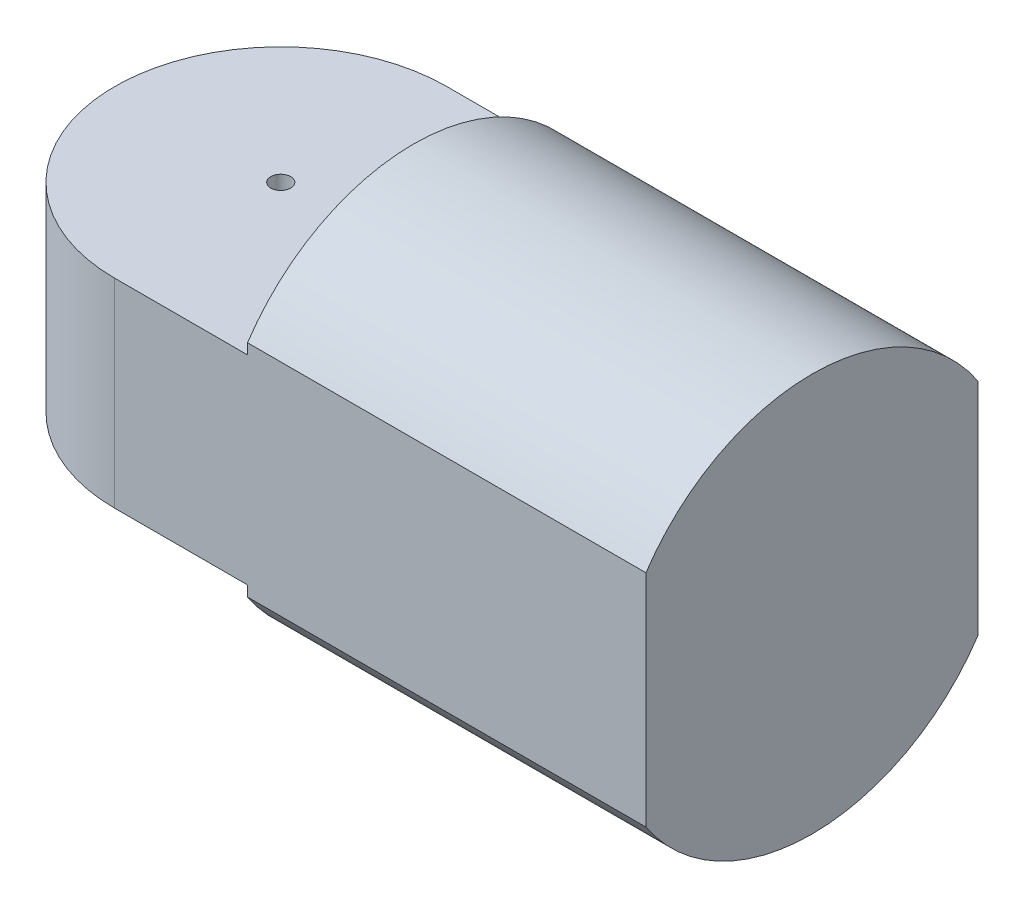
from build123d import *

# Parameters (mm, degrees)
BOSS_EXTRUDE1_DEPTH = 120
SKETCH2_W           = 100
SKETCH2_H           = 60
BOSS_EXTRUDE2_DEPTH = 90
CUT_EXTRUDE1_DEPTH  = 234.880311271
SKETCH4_R           = 3
CUT_EXTRUDE2_DEPTH  = 6


with BuildPart() as part:
    # Sketch1 → Boss-Extrude1 (new body)
    with BuildSketch(Plane(origin=(0, 0, 0), x_dir=(0, 0, -1), z_dir=(1, 0, 0))):
        with BuildLine():
            ThreePointArc((50, 33.166247904), (0, 60), (-50, 33.166247904))
            Line((-50, 33.166247904), (-50, -33.166247904))
            ThreePointArc((-50, -33.166247904), (0, -60), (50, -33.166247904))
            Line((50, -33.166247904), (50, 33.166247904))
        make_face()
    extrude(amount=-BOSS_EXTRUDE1_DEPTH)

    # Sketch2 → Boss-Extrude2 (add)
    with BuildSketch(Plane.ZY.offset(120)):
        Rectangle(SKETCH2_W, SKETCH2_H)
    extrude(amount=BOSS_EXTRUDE2_DEPTH)

    # Sketch3 → Cut-Extrude1 (cut, through all)
    with BuildSketch(Plane(origin=(0, 30, 0), x_dir=(1, 0, 0), z_dir=(0, 1, 0))):
        with BuildLine():
            ThreePointArc((-210, -4.09e-07), (-195.355339204, 35.355338915), (-160, 50))
            Line((-160, 50), (-210, 50))
            Line((-210, 50), (-210, -4.09e-07))
        make_face()
        with BuildLine():
            ThreePointArc((-160, -50), (-195.355338915, -35.355339204), (-210, -4.09e-07))
            Line((-210, -4.09e-07), (-210, -50))
            Line((-210, -50), (-160, -50))
        make_face()
    extrude(amount=-CUT_EXTRUDE1_DEPTH, mode=Mode.SUBTRACT)

    # Sketch4 → Cut-Extrude2 (cut)
    with BuildSketch(Plane(origin=(0, 30, 0), x_dir=(1, 0, 0), z_dir=(0, 1, 0))):
        with Locations((-160, 0)):
            Circle(SKETCH4_R)
    extrude(amount=-CUT_EXTRUDE2_DEPTH, mode=Mode.SUBTRACT)


solid = part.part
